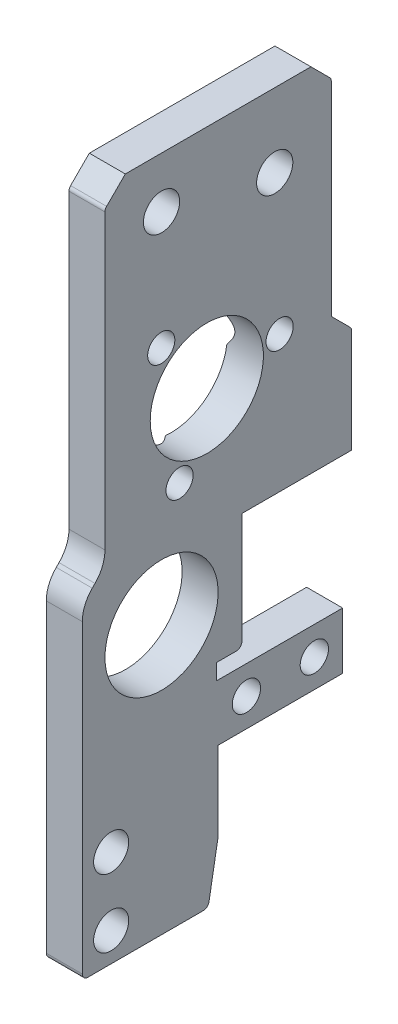
from build123d import *

# Parameters (mm, degrees)
SKETCH1_R                                       = 5
SKETCH1_R_2                                     = 1.6
SKETCH1_R_3                                     = 1.25
SKETCH1_R_4                                     = 1.55
BOSS_EXTRUDE1_DEPTH                             = 3.18
CHAMFER1_SIZE                                   = 5
CHAMFER1_SIZE2                                  = 0.881634904
CSK_FOR_M2_FLAT_HEAD_MACHINE_SCREW1_D           = 2.4
CSK_FOR_M2_FLAT_HEAD_MACHINE_SCREW1_DEPTH       = 3.508967257
CSK_FOR_M2_FLAT_HEAD_MACHINE_SCREW1_CSINK_D     = 4.4
CSK_FOR_M2_FLAT_HEAD_MACHINE_SCREW1_CSINK_ANGLE = 90
CSK_FOR_M2_FLAT_HEAD_MACHINE_SCREW1_TIP         = 0.721032743
SKETCH3_R                                       = 5
CUT_EXTRUDE4_DEPTH                              = 65.449891389
FILLET2_R                                       = 3
CHAMFER2_SIZE                                   = 1.8
FILLET4_R                                       = 0.5


with BuildPart() as part:
    # Sketch1 → Boss-Extrude1 (new body)
    with BuildSketch(Plane(origin=(0, 0, 0), x_dir=(0, 0, -1), z_dir=(1, 0, 0))):
        Polygon((0, 0), (0, 28.7), (2, 30.7), (2, 59.81), (22, 59.81), (22, 39.81), (23.8, 39.81), (23.8, 28.68), (14.1, 28.68), (14.1, 18.4), (11.85, 18.4), (11.85, 17), (23, 17), (23, 12), (12, 12), (12, 0), align=None)
        with Locations(Location((7, 23.7, 0), (0, 0, 180))):
            Circle(SKETCH1_R, mode=Mode.SUBTRACT)
        with Locations(Location((7, 55.31, 0), (0, 0, 180))):
            Circle(SKETCH1_R_2, mode=Mode.SUBTRACT)
        with Locations(Location((17, 53.31, 0), (0, 0, 180))):
            Circle(SKETCH1_R_2, mode=Mode.SUBTRACT)
        with Locations(Location((20.5, 14.5, 0), (0, 0, 180))):
            Circle(SKETCH1_R_3, mode=Mode.SUBTRACT)
        with Locations(Location((14.5, 14.5, 0), (0, 0, 180))):
            Circle(SKETCH1_R_3, mode=Mode.SUBTRACT)
        with Locations(Location((2.55, 2.55, 0), (0, 0, 180))):
            Circle(SKETCH1_R_4, mode=Mode.SUBTRACT)
        with Locations(Location((2.55, 8.55, 0), (0, 0, 180))):
            Circle(SKETCH1_R_4, mode=Mode.SUBTRACT)
    extrude(amount=BOSS_EXTRUDE1_DEPTH)

    # Chamfer1
    chamfer1_edges = [part.edges().sort_by_distance(p)[0] for p in [
        (1.59, 0, -12),
    ]]
    chamfer1_side = [part.faces().sort_by_distance(p)[0] for p in [
        (1.59, 6, -12),
    ]]
    chamfer(chamfer1_edges, length=CHAMFER1_SIZE, length2=CHAMFER1_SIZE2, reference=chamfer1_side[0])

    # CSK for M2 Flat Head Machine Screw1
    with Locations(Plane.ZY):
        with Locations((-6.974936087, 44.914674329), (-17.432559713, 40.744769284), (-8.592504199, 33.773154083)):
            CounterSinkHole(CSK_FOR_M2_FLAT_HEAD_MACHINE_SCREW1_D / 2, CSK_FOR_M2_FLAT_HEAD_MACHINE_SCREW1_CSINK_D / 2, depth=CSK_FOR_M2_FLAT_HEAD_MACHINE_SCREW1_DEPTH, counter_sink_angle=CSK_FOR_M2_FLAT_HEAD_MACHINE_SCREW1_CSINK_ANGLE)
            with Locations((0, 0, -(CSK_FOR_M2_FLAT_HEAD_MACHINE_SCREW1_DEPTH + CSK_FOR_M2_FLAT_HEAD_MACHINE_SCREW1_TIP / 2))):  # 118° drill point
                Cone(0, CSK_FOR_M2_FLAT_HEAD_MACHINE_SCREW1_D / 2, CSK_FOR_M2_FLAT_HEAD_MACHINE_SCREW1_TIP, mode=Mode.SUBTRACT)

    # Sketch3 → Cut-Extrude4 (cut, through all)
    with BuildSketch(Plane.ZY):
        with Locations((-11, 39.810865899)):
            Circle(SKETCH3_R)
    extrude(amount=-CUT_EXTRUDE4_DEPTH, mode=Mode.SUBTRACT)

    # Fillet2
    fillet2_edges = [part.edges().sort_by_distance(p)[0] for p in [
        (1.59, 28.7, 0),
        (1.59, 30.7, -2),
    ]]
    fillet(fillet2_edges, radius=FILLET2_R)

    # Chamfer2
    chamfer2_edges = [part.edges().sort_by_distance(p)[0] for p in [
        (1.59, 59.81, -22),
        (1.59, 59.81, -2),
        (1.59, 39.81, -23.8),
    ]]
    chamfer(chamfer2_edges, length=CHAMFER2_SIZE - 0.0001)  # a hair under: the kernel refuses the full size

    # Fillet4
    fillet4_edges = [part.edges().sort_by_distance(p)[0] for p in [
        (1.59, 38.0101, -23.8),
        (1.59, 58.0101, -22),
        (1.59, 58.0101, -2),
        (1.59, 0, 0),
        (1.59, 18.4, -14.1),
        (1.59, 0, -11.118365096),
    ]]
    fillet(fillet4_edges, radius=FILLET4_R)


solid = part.part
